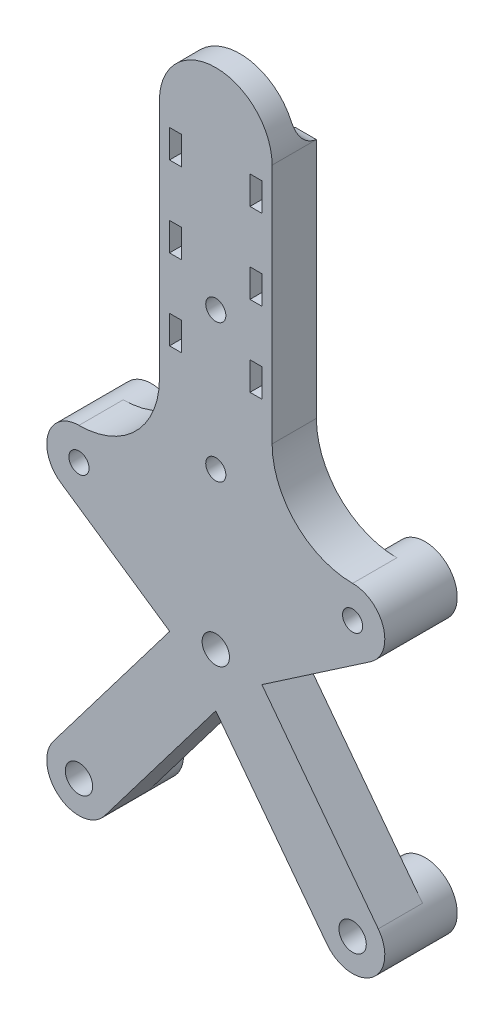
from build123d import *

# Parameters (mm, degrees)
BOSS_EXTRUDE1_DEPTH             = 3
BOSS_EXTRUDE2_START             = -6
BOSS_EXTRUDE2_DEPTH             = 6
TAP_DRILL_FOR_M3X0_5_TAP1_D     = 2.5
TAP_DRILL_FOR_M3X0_5_TAP1_DEPTH = 10
TAP_DRILL_FOR_M3X0_5_TAP1_TIP   = 0.751075774
M3_CLEARANCE_HOLE1_D            = 3.4
M3_CLEARANCE_HOLE1_DEPTH        = 10
M3_CLEARANCE_HOLE1_TIP          = 1.021463052
M3_CLEARANCE_HOLE2_D            = 3.4
M3_CLEARANCE_HOLE2_DEPTH        = 10
M3_CLEARANCE_HOLE2_TIP          = 1.021463052
BOSS_EXTRUDE3_START             = 2.5
SKETCH9_R                       = 1.7
BOSS_EXTRUDE3_DEPTH             = 2.5
TAP_DRILL_FOR_M3X0_5_TAP2_D     = 2.5
TAP_DRILL_FOR_M3X0_5_TAP2_DEPTH = 10
TAP_DRILL_FOR_M3X0_5_TAP2_TIP   = 0.751075774
SKETCH8_W                       = 1.5
SKETCH8_H                       = 3.5
CUT_EXTRUDE1_DEPTH              = 15
FILLET3_R                       = 3
FILLET4_R                       = 10


# Some blends are built 0.0001 mm under size
with BuildPart() as part:
    # Sketch1 → Boss-Extrude1 (new body)
    with BuildSketch(Plane.XY):
        with BuildLine():
            Line((-5.729559867, 10.267386408), (-20.186344056, -8.782393513))
            ThreePointArc((-20.186344056, -8.782393513), (-19.418100816, -14.386838385), (-13.813655944, -13.618595145))
            Line((-13.813655944, -13.618595145), (0, 4.583731333))
            Line((0, 4.583731333), (13.813655944, -13.618595145))
            ThreePointArc((13.813655944, -13.618595145), (19.418100816, -14.386838385), (20.186344056, -8.782393513))
            Line((20.186344056, -8.782393513), (5.729559867, 10.267386408))
            Line((5.729559867, 10.267386408), (19.254422206, 19.495329447))
            ThreePointArc((19.254422206, 19.495329447), (20.822087446, 23.979186794), (17, 26.799505671))
            Line((17, 26.799505671), (7, 26.799505671))
            Line((7, 26.799505671), (7, 66.799505671))
            ThreePointArc((7, 66.799505671), (0, 73.799505671), (-7, 66.799505671))
            Line((-7, 66.799505671), (-7, 26.799505671))
            Line((-7, 26.799505671), (-17, 26.799505671))
            ThreePointArc((-17, 26.799505671), (-20.822087446, 23.979186794), (-19.254422206, 19.495329447))
            Line((-19.254422206, 19.495329447), (-5.729559867, 10.267386408))
        make_face()
    extrude(amount=BOSS_EXTRUDE1_DEPTH)

    # Sketch1<3> → Boss-Extrude2 (add)
    with BuildSketch(Plane.XY.offset(BOSS_EXTRUDE2_START)):
        with BuildLine():
            ThreePointArc((-21, 22.799505671), (-20.536784473, 20.931042241), (-19.254422206, 19.495329447))
            ThreePointArc((-19.254422206, 19.495329447), (-15.13153657, 19.262721197), (-13, 22.799505671))
            ThreePointArc((-13, 22.799505671), (-13.463215527, 24.667969101), (-14.745577794, 26.103681895))
            ThreePointArc((-14.745577794, 26.103681895), (-15.820318877, 26.621593117), (-17, 26.799505671))
            ThreePointArc((-17, 26.799505671), (-19.828427125, 25.627932795), (-21, 22.799505671))
        make_face()
        with BuildLine():
            ThreePointArc((14.745577794, 26.103681895), (13.695823776, 20.545083465), (19.254422206, 19.495329447))
            ThreePointArc((19.254422206, 19.495329447), (20.536784473, 20.931042241), (21, 22.799505671))
            ThreePointArc((21, 22.799505671), (19.828427125, 25.627932795), (17, 26.799505671))
            ThreePointArc((17, 26.799505671), (15.820318877, 26.621593117), (14.745577794, 26.103681895))
        make_face()
        with BuildLine():
            ThreePointArc((20.186344056, -8.782393513), (14.581899184, -8.014150273), (13.813655944, -13.618595145))
            ThreePointArc((13.813655944, -13.618595145), (15.221293063, -14.783258853), (17, -15.200494329))
            ThreePointArc((17, -15.200494329), (19.828427125, -14.028921454), (21, -11.200494329))
            ThreePointArc((21, -11.200494329), (20.791132827, -9.924832976), (20.186344056, -8.782393513))
        make_face()
        with BuildLine():
            ThreePointArc((-17, -15.200494329), (-15.221293063, -14.783258853), (-13.813655944, -13.618595145))
            ThreePointArc((-13.813655944, -13.618595145), (-13.208867173, -12.476155682), (-13, -11.200494329))
            ThreePointArc((-13, -11.200494329), (-15.724338647, -7.409361502), (-20.186344056, -8.782393513))
            ThreePointArc((-20.186344056, -8.782393513), (-20.791132827, -9.924832976), (-21, -11.200494329))
            ThreePointArc((-21, -11.200494329), (-19.828427125, -14.028921454), (-17, -15.200494329))
        make_face()
    extrude(amount=BOSS_EXTRUDE2_DEPTH)

    # Tap Drill for M3x0.5 Tap1
    with Locations(Plane(origin=(0, 0, -6), x_dir=(-1, 0, 0), z_dir=(0, 0, -1))):
        with Locations((17, 22.799505671), (-17, 22.799505671)):
            Hole(TAP_DRILL_FOR_M3X0_5_TAP1_D / 2, depth=TAP_DRILL_FOR_M3X0_5_TAP1_DEPTH)
            with Locations((0, 0, -(TAP_DRILL_FOR_M3X0_5_TAP1_DEPTH + TAP_DRILL_FOR_M3X0_5_TAP1_TIP / 2))):  # 118° drill point
                Cone(0, TAP_DRILL_FOR_M3X0_5_TAP1_D / 2, TAP_DRILL_FOR_M3X0_5_TAP1_TIP, mode=Mode.SUBTRACT)

    # M3 Clearance Hole1
    with Locations(Plane(origin=(0, 0, -6), x_dir=(-1, 0, 0), z_dir=(0, 0, -1))):
        with Locations((-17, -11.200494329), (17, -11.200494329)):
            Hole(M3_CLEARANCE_HOLE1_D / 2, depth=M3_CLEARANCE_HOLE1_DEPTH)
            with Locations((0, 0, -(M3_CLEARANCE_HOLE1_DEPTH + M3_CLEARANCE_HOLE1_TIP / 2))):  # 118° drill point
                Cone(0, M3_CLEARANCE_HOLE1_D / 2, M3_CLEARANCE_HOLE1_TIP, mode=Mode.SUBTRACT)

    # M3 Clearance Hole2
    with Locations(Plane.XY.offset(3)):
        with Locations((0, 11.200494329)):
            Hole(M3_CLEARANCE_HOLE2_D / 2, depth=M3_CLEARANCE_HOLE2_DEPTH)
            with Locations((0, 0, -(M3_CLEARANCE_HOLE2_DEPTH + M3_CLEARANCE_HOLE2_TIP / 2))):  # 118° drill point
                Cone(0, M3_CLEARANCE_HOLE2_D / 2, M3_CLEARANCE_HOLE2_TIP, mode=Mode.SUBTRACT)

    # Sketch9 → Boss-Extrude3 (add)
    with BuildSketch(Plane(origin=(0, 0, 0), x_dir=(-1, 0, 0), z_dir=(0, 0, -1)).offset(BOSS_EXTRUDE3_START)):
        with BuildLine():
            Line((7, 66.799505671), (4.365625, 66.799505671))
            Line((4.365625, 66.799505671), (4.365625, 26.799505671))
            Line((4.365625, 26.799505671), (-4.365625, 26.799505671))
            Line((-4.365625, 26.799505671), (-4.365625, 66.799505671))
            Line((-4.365625, 66.799505671), (-7, 66.799505671))
            Line((-7, 66.799505671), (-7, 26.799505671))
            Line((-7, 26.799505671), (-17, 26.799505671))
            ThreePointArc((-17, 26.799505671), (-13.177912554, 21.619824548), (-19.254422206, 19.495329447))
            Line((-19.254422206, 19.495329447), (-5.729559867, 10.267386408))
            Line((-5.729559867, 10.267386408), (-20.186344056, -8.782393513))
            ThreePointArc((-20.186344056, -8.782393513), (-14.581899184, -8.014150273), (-13.813655944, -13.618595145))
            Line((-13.813655944, -13.618595145), (0, 4.583731333))
            Line((0, 4.583731333), (13.813655944, -13.618595145))
            ThreePointArc((13.813655944, -13.618595145), (14.581899184, -8.014150273), (20.186344056, -8.782393513))
            Line((20.186344056, -8.782393513), (5.729559867, 10.267386408))
            Line((5.729559867, 10.267386408), (19.254422206, 19.495329447))
            ThreePointArc((19.254422206, 19.495329447), (13.177912554, 21.619824548), (17, 26.799505671))
            Line((17, 26.799505671), (7, 26.799505671))
            Line((7, 26.799505671), (7, 66.799505671))
        make_face()
        with Locations(Location((0, 11.200494329, 0), (0, 0, 179.999999992))):
            Circle(SKETCH9_R, mode=Mode.SUBTRACT)
    extrude(amount=-BOSS_EXTRUDE3_DEPTH)

    # Tap Drill for M3x0.5 Tap2
    with Locations(Plane(origin=(0, 0, 0), x_dir=(-1, 0, 0), z_dir=(0, 0, -1))):
        with Locations((0, 30.58245731), (0, 47.72934455)):
            Hole(TAP_DRILL_FOR_M3X0_5_TAP2_D / 2, depth=TAP_DRILL_FOR_M3X0_5_TAP2_DEPTH)
            with Locations((0, 0, -(TAP_DRILL_FOR_M3X0_5_TAP2_DEPTH + TAP_DRILL_FOR_M3X0_5_TAP2_TIP / 2))):  # 118° drill point
                Cone(0, TAP_DRILL_FOR_M3X0_5_TAP2_D / 2, TAP_DRILL_FOR_M3X0_5_TAP2_TIP, mode=Mode.SUBTRACT)

    # Sketch8 → Cut-Extrude1 (cut)
    with BuildSketch(Plane.XY.offset(3)):
        with Locations((5, 42.72934455)):
            Rectangle(SKETCH8_W, SKETCH8_H)
        with Locations((-5, 42.72934455)):
            Rectangle(SKETCH8_W, SKETCH8_H)
        with Locations((5, 52.72934455)):
            Rectangle(SKETCH8_W, SKETCH8_H)
        with Locations((-5, 52.72934455)):
            Rectangle(SKETCH8_W, SKETCH8_H)
        with Locations((-5, 62.72934455)):
            Rectangle(SKETCH8_W, SKETCH8_H)
        with Locations((5, 62.72934455)):
            Rectangle(SKETCH8_W, SKETCH8_H)
    extrude(amount=-CUT_EXTRUDE1_DEPTH, mode=Mode.SUBTRACT)

    # Fillet3
    # the kernel refuses this fillet: 3 mm, written as the material it adds along each edge
    with BuildSketch(Plane(origin=(4.365625, 66.799505671, 0), x_dir=(0, 0, -1), z_dir=(1, 0, 0))) as fillet3_piece_1_section:
        with BuildLine():
            CenterArc((3, 2.958039892), FILLET3_R, 180, 80.405931773)
            Line((0, 2.958039892), (0, 0))
            Line((0, 0), (2.5, 0))
        make_face()
    fillet3_piece_1 = extrude(amount=10.029474729, mode=Mode.PRIVATE)
    fillet3_piece_1 = fillet3_piece_1 & Plane(origin=(0, 66.799505671, -0.704129577), x_dir=(1, 0, 0), z_dir=(0, 0, -1)) * Cylinder(7, 32, mode=Mode.PRIVATE)
    add(fillet3_piece_1)
    with BuildSketch(Plane(origin=(-14.395099729, 66.799505671, 0), x_dir=(0, 0, -1), z_dir=(1, 0, 0))) as fillet3_piece_2_section:
        with BuildLine():
            CenterArc((3, 2.958039892), FILLET3_R, 180, 80.405931773)
            Line((0, 2.958039892), (0, 0))
            Line((0, 0), (2.5, 0))
        make_face()
    fillet3_piece_2 = extrude(amount=10.029474729, mode=Mode.PRIVATE)
    fillet3_piece_2 = fillet3_piece_2 & Plane(origin=(0, 66.799505671, -0.704129577), x_dir=(1, 0, 0), z_dir=(0, 0, -1)) * Cylinder(7, 32, mode=Mode.PRIVATE)
    add(fillet3_piece_2)

    # Fillet4
    fillet4_edges = [part.edges().sort_by_distance(p)[0] for p in [
        (7, 26.799505671, 0.25),
        (-7, 26.799505671, 0.25),
    ]]
    fillet(fillet4_edges, radius=FILLET4_R - 0.0001)  # a hair under: the kernel refuses the full size


solid = part.part
